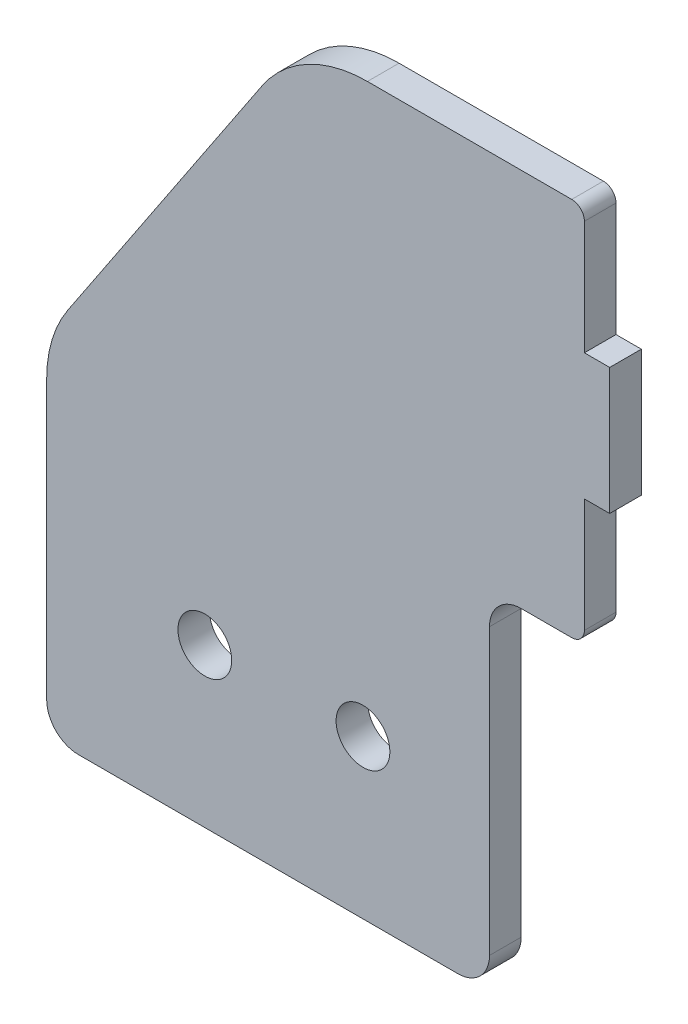
from build123d import *

# Parameters (mm, degrees)
TABAN_FLAN_1_DEPTH          = 5
IZIM8_R                     = 4.25
KES_EKSTR_ZYON1_DEPTH       = 10
RADYUS1_R                   = 20
RADYUS2_R                   = 5
RADYUS3_R                   = 2
IZIM10_W                    = 5
IZIM10_H                    = 20
Y_KSEKLIK_EKSTR_ZYON1_DEPTH = 4


# Sheet-metal steps are written as plain solids
with BuildPart() as part:
    # Çizim1 → Taban-Flanş1 (new body)
    with BuildSketch(Plane.XY):
        Polygon((0, 0), (-45, 0), (-85, -60), (-85, -115), (-15, -115), (-15, -60), (0, -60), align=None)
    extrude(amount=-TABAN_FLAN_1_DEPTH)

    # Çizim8 → Kes-Ekstrüzyon1 (cut)
    with BuildSketch(Plane.XY):
        with Locations((-35, -90)):
            Circle(IZIM8_R)
        with Locations((-60, -90)):
            Circle(IZIM8_R)
    extrude(amount=-KES_EKSTR_ZYON1_DEPTH, mode=Mode.SUBTRACT)

    # Radyus1
    radyus1_edges = [part.edges().sort_by_distance(p)[0] for p in [
        (-85, -60, -2.5),
        (-45, 0, -2.5),
    ]]
    fillet(radyus1_edges, radius=RADYUS1_R)

    # Radyus2
    radyus2_edges = [part.edges().sort_by_distance(p)[0] for p in [
        (-15, -60, -2.5),
        (-15, -115, -2.5),
        (-85, -115, -2.5),
    ]]
    fillet(radyus2_edges, radius=RADYUS2_R)

    # Radyus3
    radyus3_edges = [part.edges().sort_by_distance(p)[0] for p in [
        (0, -60, -2.5),
        (0, 0, -2.5),
    ]]
    fillet(radyus3_edges, radius=RADYUS3_R)

    # Çizim10 → Yükseklik-Ekstrüzyon1 (add)
    with BuildSketch(Plane(origin=(0, 0, 0), x_dir=(0, 0, -1), z_dir=(1, 0, 0))):
        with Locations((2.5, -30)):
            Rectangle(IZIM10_W, IZIM10_H)
    extrude(amount=Y_KSEKLIK_EKSTR_ZYON1_DEPTH)


solid = part.part
